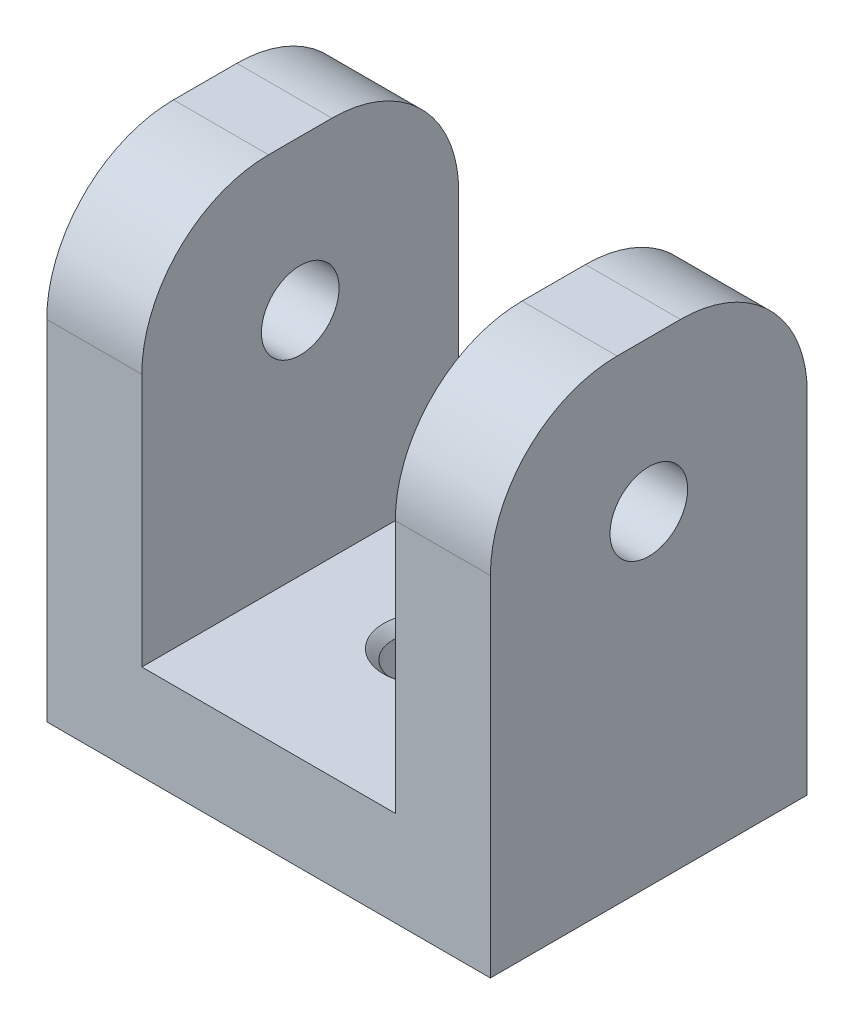
from build123d import *

# Parameters (mm, degrees)
SKETCH1_W               = 28
SKETCH1_H               = 20
BOSS_EXTRUDE1_DEPTH     = 6
SKETCH2_W               = 6
SKETCH2_H               = 20
BOSS_EXTRUDE2_DEPTH     = 24
CUT_EXTRUDE1_DEPTH      = 43.237424164
CUT_EXTRUDE1_DEPTH_BACK = 43.237424164
SKETCH3_R               = 2.45
SKETCH4_R               = 1.65
CUT_EXTRUDE2_DEPTH      = 42.952353927
SKETCH5_R               = 2.15
CUT_EXTRUDE3_DEPTH      = 3
FILLET1_SIZE            = 0.6
FILLET2_R               = 8


with BuildPart() as part:
    # Sketch1 → Boss-Extrude1 (new body)
    with BuildSketch(Plane(origin=(0, 0, 0), x_dir=(1, 0, 0), z_dir=(0, 1, 0))):
        with Locations((14, -10)):
            Rectangle(SKETCH1_W, SKETCH1_H)
    extrude(amount=BOSS_EXTRUDE1_DEPTH)

    # Sketch2 → Boss-Extrude2 (add)
    with BuildSketch(Plane(origin=(0, 6, 0), x_dir=(1, 0, 0), z_dir=(0, 1, 0))):
        with Locations((3, -10)):
            Rectangle(SKETCH2_W, SKETCH2_H)
        with Locations((25, -10)):
            Rectangle(SKETCH2_W, SKETCH2_H)
    extrude(amount=BOSS_EXTRUDE2_DEPTH)

    # Sketch3 → Cut-Extrude1 (cut, two sides: drawn at the far end of the back side and taken through both)
    with BuildSketch(Plane(origin=(6, 0, 0), x_dir=(0, 0, -1), z_dir=(1, 0, 0)).offset(-CUT_EXTRUDE1_DEPTH_BACK)):
        with Locations((-10, 20.5)):
            Circle(SKETCH3_R)
    extrude(amount=CUT_EXTRUDE1_DEPTH + CUT_EXTRUDE1_DEPTH_BACK, mode=Mode.SUBTRACT)

    # Sketch4 → Cut-Extrude2 (cut, through all)
    with BuildSketch(Plane(origin=(0, 6, 0), x_dir=(1, 0, 0), z_dir=(0, 1, 0))):
        with Locations(Location((14, -10, 0), (0, 0, 270))):
            Circle(SKETCH4_R)
    extrude(amount=-CUT_EXTRUDE2_DEPTH, mode=Mode.SUBTRACT)

    # Sketch5 → Cut-Extrude3 (cut)
    with BuildSketch(Plane(origin=(0, 6, 0), x_dir=(1, 0, 0), z_dir=(0, 1, 0))):
        with Locations(Location((14, -10, 0), (0, 0, 270))):
            Circle(SKETCH5_R)
    extrude(amount=-CUT_EXTRUDE3_DEPTH, mode=Mode.SUBTRACT)

    # Fillet1
    # a fillet whose section is not a circle: 0.6 mm, written as the material it takes off along each edge
    with BuildSketch(Plane(origin=(14, 6, 10), x_dir=(0, 0, 1), z_dir=(-1, 0, 0))) as fillet1_piece_1:
        with BuildLine():
            Bezier((2.15 + FILLET1_SIZE, 0), (2.15, 0), (2.15, -FILLET1_SIZE), weights=[1, 0.052631579, 1])
            Line((2.15, -FILLET1_SIZE), (2.15, 0))
            Line((2.15, 0), (2.15 + FILLET1_SIZE, 0))
        make_face()
    revolve(axis=Axis((14, 6, 10), (0, 1, 0)), mode=Mode.SUBTRACT)

    # Fillet2
    fillet2_edges = [part.edges().sort_by_distance(p)[0] for p in [
        (3, 30, 20),
        (3, 30, 0),
        (25, 30, 0),
        (25, 30, 20),
    ]]
    fillet(fillet2_edges, radius=FILLET2_R)


solid = part.part
